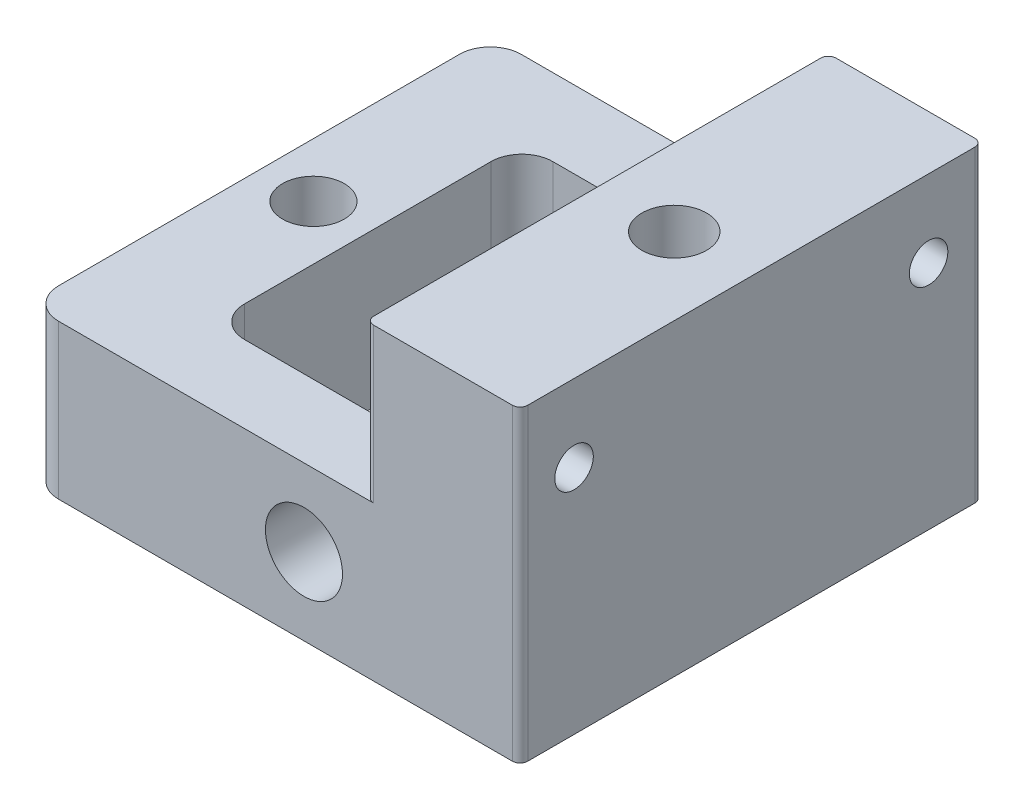
from build123d import *

# Parameters (mm, degrees)
SKETCH1_W                   = 31.93
SKETCH1_H                   = 30
SKETCH1_W_2                 = 14.88
SKETCH1_H_2                 = 20
BOSS_EXTRUDE1_DEPTH         = 10
SKETCH2_W                   = 10
SKETCH2_H                   = 30
BOSS_EXTRUDE2_DEPTH         = 10
TAP_DRILL_FOR_M5X0_8_TAP1_D = 4.2
FILLET2_R                   = 2
SKETCH5_R                   = 2.5
CUT_EXTRUDE2_DEPTH          = 37.457558887
TAP_DRILL_FOR_M4X0_7_TAP1_D = 3.3
FILLET3_R                   = 2
FILLET4_R                   = 0.5
TAP_DRILL_FOR_M3X0_5_TAP1_D = 2.5
F_4_0_4_DIAMETER_HOLE1_D    = 4


with BuildPart() as part:
    # Sketch1 → Boss-Extrude1 (new body)
    with BuildSketch(Plane(origin=(0, 0, 0), x_dir=(1, 0, 0), z_dir=(0, 1, 0))):
        with Locations((1.475, 0)):
            Rectangle(SKETCH1_W, SKETCH1_H)
        Rectangle(SKETCH1_W_2, SKETCH1_H_2, mode=Mode.SUBTRACT)
    extrude(amount=BOSS_EXTRUDE1_DEPTH)

    # Sketch2 → Boss-Extrude2 (add)
    with BuildSketch(Plane(origin=(0, 10, 0), x_dir=(1, 0, 0), z_dir=(0, 1, 0))):
        with Locations((12.44, 0)):
            Rectangle(SKETCH2_W, SKETCH2_H)
    extrude(amount=BOSS_EXTRUDE2_DEPTH)

    # Tap Drill for M5x0.8 Tap1 (through all)
    with Locations(Plane(origin=(0, 20, 0), x_dir=(1, 0, 0), z_dir=(0, 1, 0))):
        with Locations((12.44, 0)):
            Hole(TAP_DRILL_FOR_M5X0_8_TAP1_D / 2)

    # Fillet2
    fillet2_edges = [part.edges().sort_by_distance(p)[0] for p in [
        (-7.44, 5, 10),
        (-7.44, 5, -10),
        (7.44, 5, -10),
        (7.44, 5, 10),
    ]]
    fillet(fillet2_edges, radius=FILLET2_R)

    # Sketch5 → Cut-Extrude2 (cut, through all)
    with BuildSketch(Plane.XY.offset(-10)):
        with Locations((3.42, 5)):
            Circle(SKETCH5_R)
    extrude(amount=CUT_EXTRUDE2_DEPTH, mode=Mode.SUBTRACT)

    # Tap Drill for M4x0.7 Tap1 (through all)
    with Locations(Plane.XY.offset(-10)):
        with Locations((3.42, 5)):
            Hole(TAP_DRILL_FOR_M4X0_7_TAP1_D / 2)

    # Fillet3
    fillet3_edges = [part.edges().sort_by_distance(p)[0] for p in [
        (-14.49, 5, -15),
        (-14.49, 5, 15),
    ]]
    fillet(fillet3_edges, radius=FILLET3_R)

    # Fillet4
    fillet4_edges = [part.edges().sort_by_distance(p)[0] for p in [
        (17.44, 10, 15),
        (17.44, 10, -15),
        (7.44, 15, -15),
        (7.44, 15, 15),
    ]]
    fillet(fillet4_edges, radius=FILLET4_R)

    # Tap Drill for M3x0.5 Tap1 (through all)
    with Locations(Plane.ZY.offset(-7.44)):
        with Locations((-11.5, 15), (11.5, 15)):
            Hole(TAP_DRILL_FOR_M3X0_5_TAP1_D / 2)

    # Ø4.0 (4) Diameter Hole1 (through all)
    with Locations(Plane(origin=(0, 10, 0), x_dir=(1, 0, 0), z_dir=(0, 1, 0))):
        with Locations((-10.965, 0)):
            Hole(F_4_0_4_DIAMETER_HOLE1_D / 2)


solid = part.part
